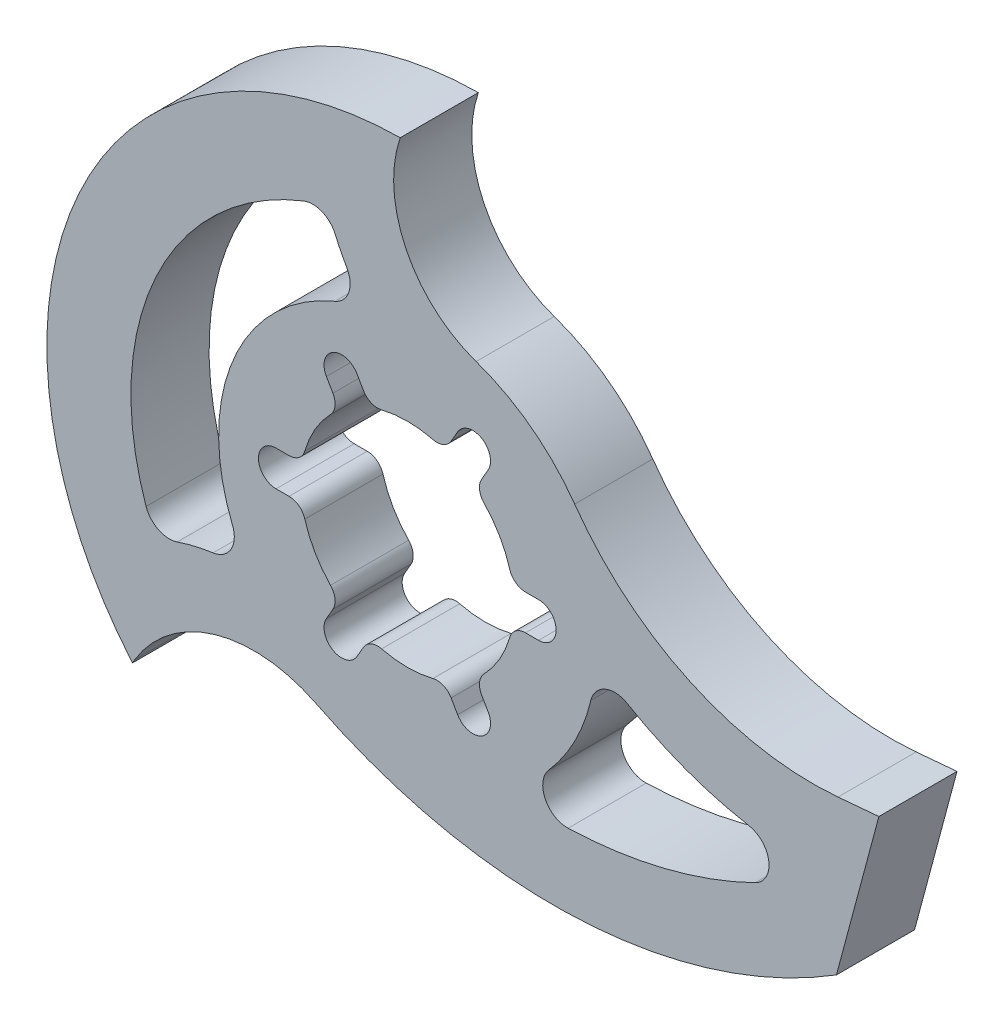
from build123d import *

# Parameters (mm, degrees)
BOSS_EXTRUDE1_DEPTH = 9.525
CUT_EXTRUDE1_DEPTH  = 73.128249301
FILLET1_R           = 3


with BuildPart() as part:
    # Sketch1 → Boss-Extrude1 (new body)
    with BuildSketch(Plane.XY):
        with BuildLine():
            Line((57.5, 0), (52.323619098, -19.318516526))
            ThreePointArc((52.323619098, -19.318516526), (20.979376872, -29.133045959), (-11.16168255, -22.369998718))
            ThreePointArc((-11.16168255, -22.369998718), (-23.463164293, -21.269776952), (-33.234971317, -28.822837821))
            ThreePointArc((-33.234971317, -28.822837821), (-33.370829173, -29.054601428), (-33.502514552, -29.288760963))
            ThreePointArc((-33.502514552, -29.288760963), (-40.041961125, 16.996804089), (-0.86097487, 42.491278191))
            ThreePointArc((-0.86097487, 42.491278191), (-0.15056221, 31.08043081), (8.39445333, 23.484719289))
            ThreePointArc((8.39445333, 23.484719289), (15.106566293, 19.900329169), (20.407227726, 14.441089174))
            ThreePointArc((20.407227726, 14.441089174), (34.479914708, 2.721880651), (52.51902651, -0.435778714))
            Line((52.51902651, -0.435778714), (57.5, 0))
        make_face()
    extrude(amount=BOSS_EXTRUDE1_DEPTH)

    # Sketch2 → Cut-Extrude1 (cut, through all)
    with BuildSketch(Plane.XY.offset(9.525)):
        with BuildLine():
            Line((16, -2.15), (14.414489238, -2.15))
            ThreePointArc((14.414489238, -2.15), (13.211714668, -2.552084691), (12.49255734, -3.596666667))
            ThreePointArc((12.49255734, -3.596666667), (11.258330249, -6.5), (9.361083372, -9.020538681))
            ThreePointArc((9.361083372, -9.020538681), (8.816027509, -10.165638184), (9.069199237, -11.408313863))
            Line((9.069199237, -11.408313863), (9.861954618, -12.781406461))
            ThreePointArc((9.861954618, -12.781406461), (9.075, -15.718361079), (6.138045382, -14.931406461))
            Line((6.138045382, -14.931406461), (5.345290001, -13.558313863))
            ThreePointArc((5.345290001, -13.558313863), (4.395687159, -12.717722876), (3.131473968, -12.617205348))
            ThreePointArc((3.131473968, -12.617205348), (0, -13), (-3.131473968, -12.617205348))
            ThreePointArc((-3.131473968, -12.617205348), (-4.395687159, -12.717722876), (-5.345290001, -13.558313863))
            Line((-5.345290001, -13.558313863), (-6.138045382, -14.931406461))
            ThreePointArc((-6.138045382, -14.931406461), (-9.075, -15.718361079), (-9.861954618, -12.781406461))
            Line((-9.861954618, -12.781406461), (-9.069199237, -11.408313863))
            ThreePointArc((-9.069199237, -11.408313863), (-8.816027509, -10.165638184), (-9.361083372, -9.020538681))
            ThreePointArc((-9.361083372, -9.020538681), (-11.258330249, -6.5), (-12.49255734, -3.596666667))
            ThreePointArc((-12.49255734, -3.596666667), (-13.211714668, -2.552084691), (-14.414489238, -2.15))
            Line((-14.414489238, -2.15), (-16, -2.15))
            ThreePointArc((-16, -2.15), (-18.15, 0), (-16, 2.15))
            Line((-16, 2.15), (-14.414489238, 2.15))
            ThreePointArc((-14.414489238, 2.15), (-13.211714668, 2.552084691), (-12.49255734, 3.596666667))
            ThreePointArc((-12.49255734, 3.596666667), (-11.258330249, 6.5), (-9.361083372, 9.020538681))
            ThreePointArc((-9.361083372, 9.020538681), (-8.816027509, 10.165638184), (-9.069199237, 11.408313863))
            Line((-9.069199237, 11.408313863), (-9.861954618, 12.781406461))
            ThreePointArc((-9.861954618, 12.781406461), (-9.075, 15.718361079), (-6.138045382, 14.931406461))
            Line((-6.138045382, 14.931406461), (-5.345290001, 13.558313863))
            ThreePointArc((-5.345290001, 13.558313863), (-4.395687159, 12.717722876), (-3.131473968, 12.617205348))
            ThreePointArc((-3.131473968, 12.617205348), (0, 13), (3.131473968, 12.617205348))
            ThreePointArc((3.131473968, 12.617205348), (4.395687159, 12.717722876), (5.345290001, 13.558313863))
            Line((5.345290001, 13.558313863), (6.138045382, 14.931406461))
            ThreePointArc((6.138045382, 14.931406461), (9.075, 15.718361079), (9.861954618, 12.781406461))
            Line((9.861954618, 12.781406461), (9.069199237, 11.408313863))
            ThreePointArc((9.069199237, 11.408313863), (8.816027509, 10.165638184), (9.361083372, 9.020538681))
            ThreePointArc((9.361083372, 9.020538681), (11.258330249, 6.5), (12.49255734, 3.596666667))
            ThreePointArc((12.49255734, 3.596666667), (13.211714668, 2.552084691), (14.414489238, 2.15))
            Line((14.414489238, 2.15), (16, 2.15))
            ThreePointArc((16, 2.15), (18.15, 0), (16, -2.15))
        make_face()
        with BuildLine():
            ThreePointArc((41.629548482, -8.884278362), (31.844338712, -5.956489715), (22.983284135, -0.876727087))
            ThreePointArc((22.983284135, -0.876727087), (19.726973296, -11.825672268), (11.604813905, -19.857701132))
            ThreePointArc((11.604813905, -19.857701132), (27.391859471, -19.390596404), (42.420601779, -14.534064802))
            ThreePointArc((42.420601779, -14.534064802), (44.07580442, -11.422039284), (41.629548482, -8.884278362))
        make_face()
        with BuildLine():
            ThreePointArc((-8.818698642, 21.242188076), (-21.222039888, 8.867075222), (-21.309926808, -8.653728643))
            ThreePointArc((-21.309926808, -8.653728643), (-21.490948324, -11.281682396), (-23.675413606, -12.753762947))
            ThreePointArc((-23.675413606, -12.753762947), (-27.256807595, -13.53550767), (-30.677372697, -14.85355247))
            ThreePointArc((-30.677372697, -14.85355247), (-30.672722487, 12.838532857), (-9.70422746, 30.926479887))
            ThreePointArc((-9.70422746, 30.926479887), (-8.707801535, 28.155740852), (-7.37958409, 25.527871403))
            ThreePointArc((-7.37958409, 25.527871403), (-7.12502172, 23.057924433), (-8.818698642, 21.242188076))
        make_face()
    extrude(amount=-CUT_EXTRUDE1_DEPTH, mode=Mode.SUBTRACT)

    # Fillet1
    fillet1_edges = [part.edges().sort_by_distance(p)[0] for p in [
        (22.983284135, -0.876727087, 4.7625),
        (11.604813905, -19.857701132, 4.7625),
        (-9.70422746, 30.926479887, 4.7625),
        (-30.677372697, -14.85355247, 4.7625),
    ]]
    fillet(fillet1_edges, radius=FILLET1_R)


solid = part.part
